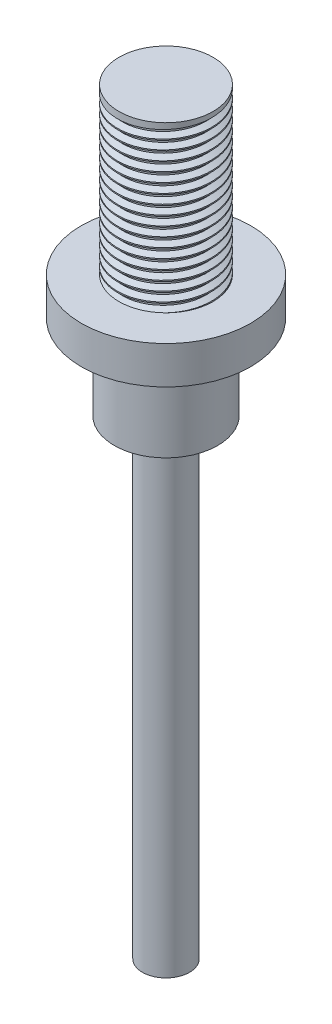
from build123d import *

# Parameters (mm, degrees)
SKETCH1_R           = 9
BOSS_EXTRUDE1_DEPTH = 4
SKETCH2_R           = 5
BOSS_EXTRUDE2_DEPTH = 17.5
SKETCH3_R           = 5.5
BOSS_EXTRUDE3_DEPTH = 9
THREAD1_PITCH       = 1
SKETCH6_R           = 2.5
BOSS_EXTRUDE4_DEPTH = 50


with BuildPart() as part:
    # Sketch1 → Boss-Extrude1 (new body)
    with BuildSketch(Plane(origin=(0, 0, 0), x_dir=(1, 0, 0), z_dir=(0, 1, 0))):
        with Locations(Location((0, 0, 0), (0, 0, 270))):
            Circle(SKETCH1_R)
    extrude(amount=BOSS_EXTRUDE1_DEPTH)

    # Sketch2 → Boss-Extrude2 (add)
    with BuildSketch(Plane(origin=(0, 4, 0), x_dir=(1, 0, 0), z_dir=(0, 1, 0))):
        with Locations(Location((0, 0, 0), (0, 0, 270))):
            Circle(SKETCH2_R)
    extrude(amount=BOSS_EXTRUDE2_DEPTH)

    # Sketch3 → Boss-Extrude3 (add)
    with BuildSketch(Plane.XZ):
        with Locations(Location((0, 0, 0), (0, 0, 270))):
            Circle(SKETCH3_R)
    extrude(amount=BOSS_EXTRUDE3_DEPTH)

    # Thread1: the profile of Thread Profile1 profile screwed along a right-hand helix of 17.5 turns, 8 arcs to a turn; built about Z, then put on its axis
    thread1_z = Axis((0, 0, 0), (0, 0, 1))
    thread1_corners = [(5.0003, 0, -0.000173205), (5.0003, 0, 0.875173202), (4.458734125, 0, 0.562499999), (4.458734125, 0, 0.312499999)]
    with BuildLine(mode=Mode.PRIVATE) as thread1_profile:
        Line(thread1_corners[0], thread1_corners[1])
        Line(thread1_corners[1], thread1_corners[2])
        Line(thread1_corners[2], thread1_corners[3])
        Line(thread1_corners[3], thread1_corners[0])
    thread1_cap = Face(thread1_profile.wire())
    thread1_turn_angles = [0, 22.5, 45, 67.5, 90, 112.5, 135, 157.5, 180, 202.5, 225, 247.5, 270, 292.5, 315, 337.5, 360]
    thread1_turn_weights = [1, 0.9238795325112867, 1, 0.9238795325112867, 1, 0.9238795325112867, 1, 0.9238795325112867, 1, 0.9238795325112867, 1, 0.9238795325112867, 1, 0.9238795325112867, 1, 0.9238795325112867, 1]
    thread1_turn_rails = [Edge.make_bspline([Vector(p[0], p[1], 0).rotate(thread1_z, thread1_turn_angles[k]) / thread1_turn_weights[k] + Vector(0, 0, p[2] + THREAD1_PITCH * thread1_turn_angles[k] / 360) for k in range(17)], [0, 0, 0, 1, 1, 2, 2, 3, 3, 4, 4, 5, 5, 6, 6, 7, 7, 8, 8, 8], 2, thread1_turn_weights) for p in thread1_corners]
    thread1_turn_sides = [Face.make_surface_from_curves(thread1_turn_rails[p[0]], thread1_turn_rails[p[1]]) for p in [(0, 1), (1, 2), (2, 3), (3, 0)]]
    thread1_last_angles = [6120, 6142.5, 6165, 6187.5, 6210, 6232.5, 6255, 6277.5, 6300]
    thread1_last_weights = [1, 0.9238795325112867, 1, 0.9238795325112867, 1, 0.9238795325112867, 1, 0.9238795325112867, 1]
    thread1_last_rails = [Edge.make_bspline([Vector(p[0], p[1], 0).rotate(thread1_z, thread1_last_angles[k]) / thread1_last_weights[k] + Vector(0, 0, p[2] + THREAD1_PITCH * thread1_last_angles[k] / 360) for k in range(9)], [0, 0, 0, 1, 1, 2, 2, 3, 3, 4, 4, 4], 2, thread1_last_weights) for p in thread1_corners]
    thread1_last_sides = [Face.make_surface_from_curves(thread1_last_rails[p[0]], thread1_last_rails[p[1]]) for p in [(0, 1), (1, 2), (2, 3), (3, 0)]]
    thread1 = Plane(origin=(0, 21.5, 0), x_dir=(-1, 0, 0), z_dir=(0, -1, 0)) * Solid(Shell([*[p.moved(Location((0, 0, THREAD1_PITCH * i))) for i in range(17) for p in thread1_turn_sides], *thread1_last_sides, thread1_cap, thread1_cap.rotate(thread1_z, 6300).moved(Location((0, 0, THREAD1_PITCH * 6300 / 360)))]))
    add(thread1, mode=Mode.SUBTRACT)

    # Sketch6 → Boss-Extrude4 (add)
    with BuildSketch(Plane.XZ.offset(9)):
        with Locations(Location((0, 0, 0), (0, 0, 270))):
            Circle(SKETCH6_R)
    extrude(amount=BOSS_EXTRUDE4_DEPTH)


solid = part.part
